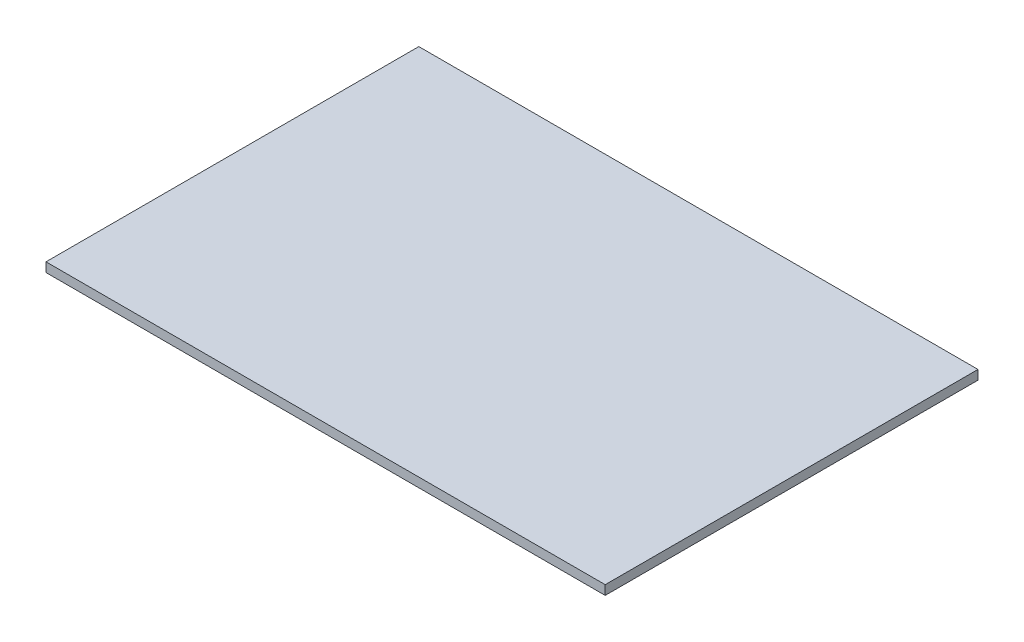
from build123d import *

# Parameters (mm, degrees)
SKETCH2_W           = 190.5
SKETCH2_H           = 127
BOSS_EXTRUDE1_DEPTH = 3.175


with BuildPart() as part:
    # Sketch2 → Boss-Extrude1 (new body)
    with BuildSketch(Plane(origin=(0, 0, 0), x_dir=(1, 0, 0), z_dir=(0, 1, 0))):
        Rectangle(SKETCH2_W, SKETCH2_H)
    extrude(amount=BOSS_EXTRUDE1_DEPTH)


solid = part.part
